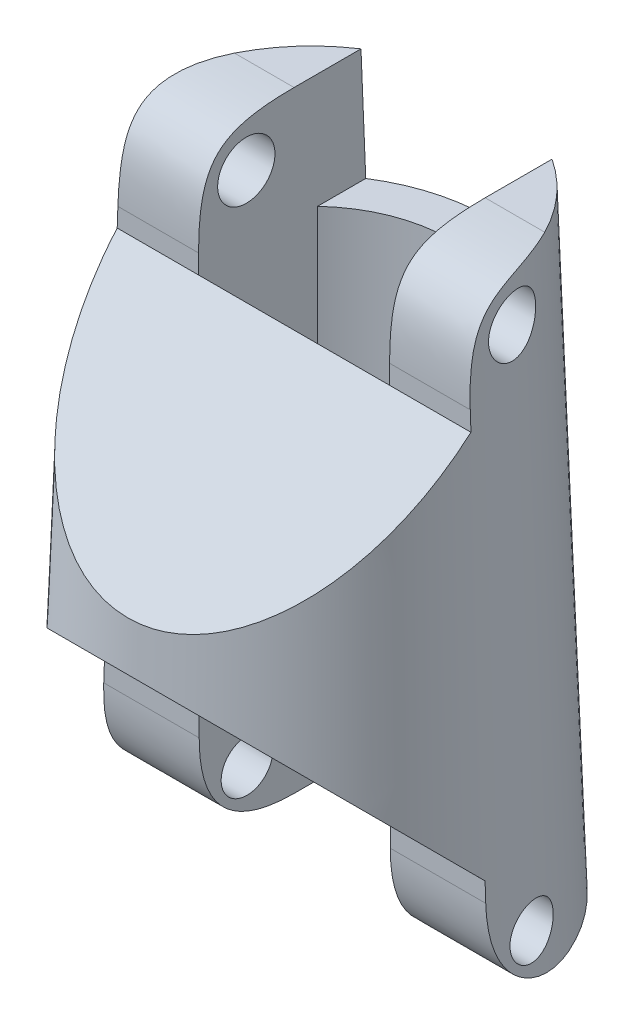
from build123d import *

# Parameters (mm, degrees)
SKETCH1_R                     = 10
BOSS_EXTRUDE1_DEPTH           = 26
BOSS_EXTRUDE1_TAPER           = 2
BOSS_EXTRUDE1_OTHER_WAY_DEPTH = 6
BOSS_EXTRUDE1_OTHER_WAY_TAPER = -2
CUT_EXTRUDE1_DEPTH            = 30.740019936
CUT_EXTRUDE1_DEPTH_BACK       = 30.740019936
SKETCH3_W                     = 10
SKETCH3_H                     = 6
CUT_EXTRUDE2_DEPTH            = 25
CUT_EXTRUDE3_DEPTH            = 32.805094434
CUT_EXTRUDE3_DEPTH_BACK       = 32.805094434
SKETCH4_R                     = 1.5
FILLET2_SIZE                  = 5
CUT_EXTRUDE5_DEPTH            = 30.740020092
CUT_EXTRUDE5_DEPTH_BACK       = 30.740020092
SKETCH8_W                     = 10
SKETCH8_H                     = 6
CUT_EXTRUDE6_DEPTH            = 31.050909814
CUT_EXTRUDE7_DEPTH            = 30.668744533
CUT_EXTRUDE8_DEPTH            = 32.738456946
CUT_EXTRUDE8_DEPTH_BACK       = 32.738456946
SKETCH9_R                     = 1.351518808
FILLET3_SIZE                  = 5


with BuildPart() as part:
    # Sketch1 → Boss-Extrude1 (new body)
    with BuildSketch(Plane(origin=(0, 0, 0), x_dir=(1, 0, 0), z_dir=(0, 1, 0))):
        Circle(SKETCH1_R)
    extrude(amount=BOSS_EXTRUDE1_DEPTH, taper=BOSS_EXTRUDE1_TAPER)

    # Sketch1 → Boss-Extrude1 other way (add)
    with BuildSketch(Plane(origin=(0, 0, 0), x_dir=(1, 0, 0), z_dir=(0, 1, 0))):
        Circle(SKETCH1_R)
    extrude(amount=-BOSS_EXTRUDE1_OTHER_WAY_DEPTH, taper=BOSS_EXTRUDE1_OTHER_WAY_TAPER)

    # Sketch2 → Cut-Extrude1 (cut, two sides: drawn at the far end of the back side and taken through both)
    with BuildSketch(Plane(origin=(0, 0, 0), x_dir=(0, 0, -1), z_dir=(1, 0, 0)).offset(-CUT_EXTRUDE1_DEPTH_BACK)):
        Polygon((-0.907940007, 26), (-0.907940007, 20), (-13.415596948, 7.492343059), (-13.415596948, 26), align=None)
    extrude(amount=CUT_EXTRUDE1_DEPTH + CUT_EXTRUDE1_DEPTH_BACK, mode=Mode.SUBTRACT)

    # Sketch3 → Cut-Extrude2 (cut)
    with BuildSketch(Plane.XY.offset(0.907940007)):
        with Locations((0, 23)):
            Rectangle(SKETCH3_W, SKETCH3_H)
    extrude(amount=-CUT_EXTRUDE2_DEPTH, mode=Mode.SUBTRACT)

    # Sketch4 → Cut-Extrude3 (cut, two sides: drawn at the far end of the back side and taken through both)
    with BuildSketch(Plane(origin=(-5, 0, 0), x_dir=(0, 0, -1), z_dir=(1, 0, 0)).offset(-CUT_EXTRUDE3_DEPTH_BACK)):
        with Locations((1.592059993, 23.5)):
            Circle(SKETCH4_R)
    extrude(amount=CUT_EXTRUDE3_DEPTH + CUT_EXTRUDE3_DEPTH_BACK, mode=Mode.SUBTRACT)

    # Fillet2
    # a fillet whose section is not a circle: 5 mm, written as the material it takes off along each edge
    with BuildSketch(Plane(origin=(-7.5, 26, 0.907940007), x_dir=(0, -1, 0), z_dir=(1, 0, 0))) as fillet2_piece_1:
        with BuildLine():
            Bezier((FILLET2_SIZE, 0), (0, 0), (0, FILLET2_SIZE), weights=[1, 1.5, 1])
            Line((0, FILLET2_SIZE), (0, 0))
            Line((0, 0), (FILLET2_SIZE, 0))
        make_face()
    extrude(amount=29.046612618, mode=Mode.SUBTRACT)
    with BuildSketch(Plane(origin=(-21.546612618, 26, 0.907940007), x_dir=(0, 0, -1), z_dir=(1, 0, 0))) as fillet2_piece_2:
        with BuildLine():
            Bezier((FILLET2_SIZE, 0), (0, 0), (0, -FILLET2_SIZE), weights=[1, 1.5, 1])
            Line((0, -FILLET2_SIZE), (0, 0))
            Line((0, 0), (FILLET2_SIZE, 0))
        make_face()
    extrude(amount=29.046612618, mode=Mode.SUBTRACT)

    # Sketch7 → Cut-Extrude5 (cut, two sides: drawn at the far end of the back side and taken through both)
    with BuildSketch(Plane(origin=(0, 0, 0), x_dir=(0, 0, -1), z_dir=(1, 0, 0)).offset(-CUT_EXTRUDE5_DEPTH_BACK)):
        Polygon((-0.873019237, -6), (-0.873019237, 0), (-11.31781305, 10.444793812), (-11.31781305, -6), align=None)
    extrude(amount=CUT_EXTRUDE5_DEPTH + CUT_EXTRUDE5_DEPTH_BACK, mode=Mode.SUBTRACT)

    # Sketch8 → Cut-Extrude6 (cut, through all)
    with BuildSketch(Plane.XY.offset(0.873019237)):
        with Locations((0, -3)):
            Rectangle(SKETCH8_W, SKETCH8_H)
    extrude(amount=-CUT_EXTRUDE6_DEPTH, mode=Mode.SUBTRACT)

    # Sketch6 → Cut-Extrude7 (cut, through all)
    with BuildSketch(Plane(origin=(0, 20, 0), x_dir=(1, 0, 0), z_dir=(0, 1, 0))):
        with BuildLine():
            Line((5, 5.321009098), (5, -0.907940007))
            Line((5, -0.907940007), (-5, -0.907940007))
            Line((-5, -0.907940007), (-5, 5.321009098))
            ThreePointArc((-5, 5.321009098), (0, 7.30158461), (5, 5.321009098))
        make_face()
    extrude(amount=-CUT_EXTRUDE7_DEPTH, mode=Mode.SUBTRACT)

    # Sketch9 → Cut-Extrude8 (cut, two sides: drawn at the far end of the back side and taken through both)
    with BuildSketch(Plane(origin=(-5, 0, 0), x_dir=(0, 0, -1), z_dir=(1, 0, 0)).offset(-CUT_EXTRUDE8_DEPTH_BACK)):
        with Locations((1.626980763, -3.5)):
            Circle(SKETCH9_R)
    extrude(amount=CUT_EXTRUDE8_DEPTH + CUT_EXTRUDE8_DEPTH_BACK, mode=Mode.SUBTRACT)

    # Fillet3
    # a fillet whose section is not a circle: 5 mm, written as the material it takes off along each edge
    with BuildSketch(Plane(origin=(22.672130078, -6, 0.873019237), x_dir=(0, 0, -1), z_dir=(-1, 0, 0))) as fillet3_piece_1:
        with BuildLine():
            Bezier((FILLET3_SIZE, 0), (0, 0), (0, -FILLET3_SIZE), weights=[1, 1, 1])
            Line((0, -FILLET3_SIZE), (0, 0))
            Line((0, 0), (FILLET3_SIZE, 0))
        make_face()
    extrude(amount=30.172130078, mode=Mode.SUBTRACT)
    with BuildSketch(Plane(origin=(7.5, -6, 0.873019237), x_dir=(0, 1, 0), z_dir=(-1, 0, 0))) as fillet3_piece_2:
        with BuildLine():
            Bezier((FILLET3_SIZE, 0), (0, 0), (0, FILLET3_SIZE), weights=[1, 1, 1])
            Line((0, FILLET3_SIZE), (0, 0))
            Line((0, 0), (FILLET3_SIZE, 0))
        make_face()
    extrude(amount=30.172130078, mode=Mode.SUBTRACT)


solid = part.part
